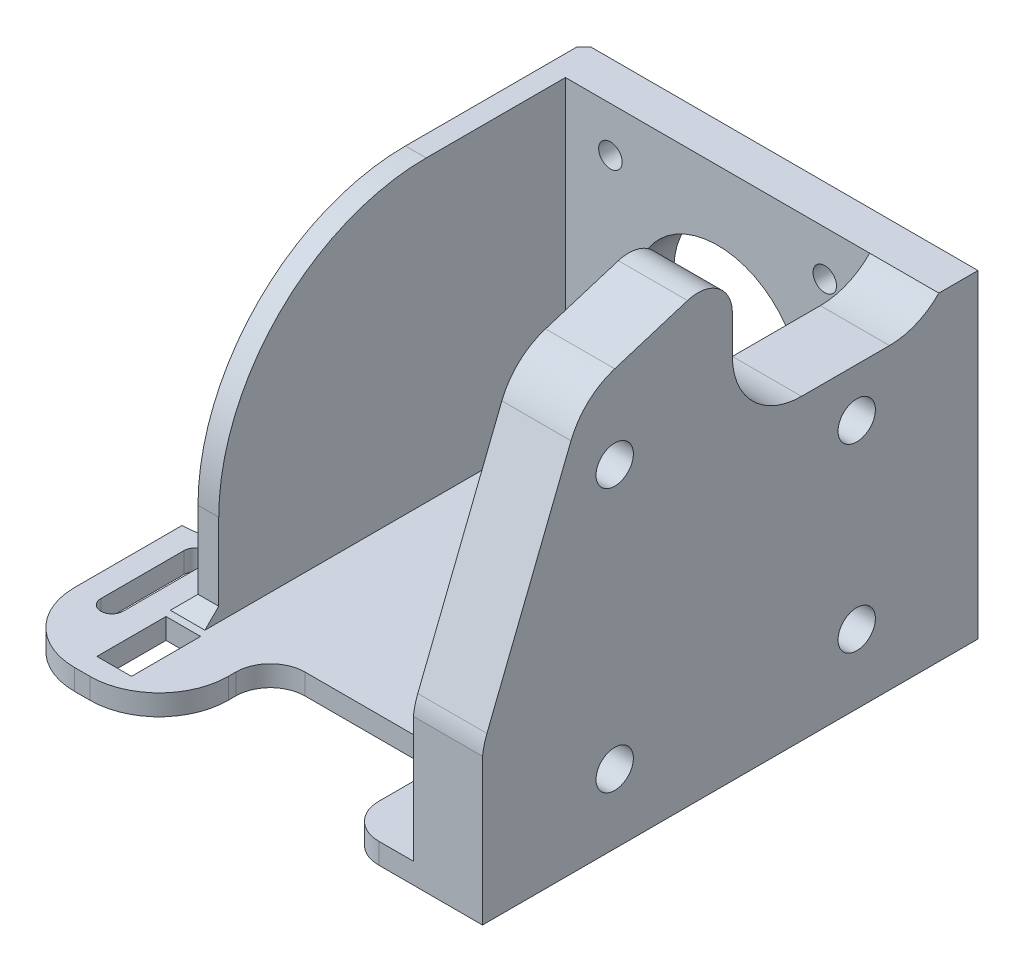
from build123d import *

# Parameters (mm, degrees)
SKETCH_1_W            = 44
SKETCH_1_H            = 44
EXTRUDE_2_DEPTH       = 5
SKETCH_2_R            = 1.5
SKETCH_2_R_2          = 10
CUT_EXTRUDE_1_DEPTH   = 32.511902513
SKETCH_3_R            = 12
CUT_EXTRUDE_3_DEPTH   = 32.511902513
EXTRUDE_4_DEPTH       = 3
EXTRUDE_5_REACH       = 63.87
SKETCH_6_W            = 44
SKETCH_6_H            = 0.85
SKETCH_7_W            = 44
SKETCH_7_H            = 0.85
CUT_EXTRUDE_4_DEPTH   = 62.869792746
SKETCH_8_W            = 52.142796764
SKETCH_8_H            = 46.15
EXTRUDE_6_DEPTH       = 3
SKETCH_10_W           = 3
SKETCH_10_H           = 43.15
SKETCH_10_W_2         = 47
SKETCH_10_H_2         = 3
EXTRUDE_7_DEPTH       = 3
SKETCH_11_W           = 1
SKETCH_11_H           = 46.15
CUT_EXTRUDE_5_DEPTH   = 77.373755538
SKETCH_12_R           = 1.55
CUT_EXTRUDE_6_DEPTH   = 65.340228018
SKETCH_14_W           = 54.142796764
SKETCH_14_H           = 46.15
EXTRUDE_8_DEPTH       = 5
EXTRUDE_9_DEPTH       = 5
SKETCH_17_W           = 70
SKETCH_17_H           = 13.120666122
EXTRUDE_10_DEPTH      = 5
CUT_EXTRUDE_8_DEPTH   = 98.040990462
EXTRUDE_12_DEPTH      = 5
CUT_EXTRUDE_9_DEPTH   = 98.040990462
FILLET_2_R            = 5
SKETCH_23_W           = 10
SKETCH_23_H           = 15.857203236
EXTRUDE_13_DEPTH      = 3
FILLET_3_R            = 5
FILLET_4_R            = 5
EXTRUDE_14_DEPTH      = 3
FILLET_5_R            = 5
SKETCH_26_W           = 3
SKETCH_26_H           = 25.543326292
CUT_EXTRUDE_10_DEPTH  = 102.638722513
FILLET_10_R           = 10
FILLET_11_R           = 12
CHAMFER_1_SIZE        = 2
CUT_EXTRUDE_11_DEPTH  = 101.502684118
FILLET_12_R           = 30
SKETCH_28_W           = 2
SKETCH_28_H           = 10
CUT_EXTRUDE_12_DEPTH  = 5
CHAMFER_2_SIZE        = 1
SKETCH_29_R           = 2.55
CUT_EXTRUDE_14_DEPTH  = 12
SKETCH_30_R           = 4.5
CUT_EXTRUDE_15_DEPTH  = 4
FILLET_13_R           = 1
SKETCH_33_R           = 7.046537577
EXTRUDE_15_DEPTH      = 10
CUT_EXTRUDE_START     = -10
CUT_EXTRUDE_16_DEPTH  = 10
SKETCH_35_R           = 4.5
CUT_EXTRUDE_17_DEPTH  = 4
FILLET_15_R           = 1
SKETCH_36_R           = 1.7
CUT_EXTRUDE_18_DEPTH  = 10
EXTRUDE_16_DEPTH      = 1.66
EXTRUDE_16_DEPTH_BACK = 2
SKETCH_37_W           = 57
SKETCH_37_H           = 46.15
SKETCH_37_R           = 1.7
CHAMFER_3_SIZE        = 1
SKETCH_38_W           = 29.862624896
SKETCH_38_H           = 3
CUT_EXTRUDE_19_DEPTH  = 101.429822344
FILLET_16_R           = 10
SKETCH_39_R           = 2.7
CUT_EXTRUDE_20_DEPTH  = 10
SKETCH_40_R           = 12
CUT_EXTRUDE_21_DEPTH  = 10
SKETCH_41_R           = 5.5
CUT_EXTRUDE_22_DEPTH  = 4
FILLET_17_R           = 1
SKETCH_42_W           = 5
SKETCH_42_H           = 10
CUT_EXTRUDE_23_DEPTH  = 10


# Read off the part's stored shape, not the designer's step: Вырез-Вытянуть16
with BuildPart() as part:
    # Эскиз1 → Бобышка-Вытянуть2 (new body)
    with BuildSketch(Plane.XY):
        Rectangle(SKETCH_1_W, SKETCH_1_H)
    extrude(amount=EXTRUDE_2_DEPTH)

    # Эскиз2 → Вырез-Вытянуть1 (cut, through all)
    with BuildSketch(Plane.XY.offset(5)):
        with Locations((-15.5, 15.5)):
            Circle(SKETCH_2_R)
        Circle(SKETCH_2_R_2)
        with Locations((15.5, 15.5)):
            Circle(SKETCH_2_R)
        with Locations((15.5, -15.5)):
            Circle(SKETCH_2_R)
        with Locations((-15.5, -15.5)):
            Circle(SKETCH_2_R)
    extrude(amount=-CUT_EXTRUDE_1_DEPTH, mode=Mode.SUBTRACT)

    # Эскиз3 → Вырез-Вытянуть3 (cut, through all)
    with BuildSketch(Plane.XY.offset(5)):
        Circle(SKETCH_3_R)
    extrude(amount=-CUT_EXTRUDE_3_DEPTH, mode=Mode.SUBTRACT)

    # Эскиз5 → Бобышка-Вытянуть4 (add)
    with BuildSketch(Plane.XZ.offset(22)):
        Polygon((-22, 5), (-22, 52.142796764), (22, 52.142796764), (22, 5), (22, 0), (-22, 0), align=None)
    extrude(amount=EXTRUDE_4_DEPTH)

    # Эскиз6 → Бобышка-Вытянуть5 (add, up to next)
    with BuildSketch(Plane.XY.offset(52.142796764), mode=Mode.PRIVATE) as extrude_5_sk1:
        with Locations((0, -21.575)):
            Rectangle(SKETCH_6_W, SKETCH_6_H)
    extrude_5_tool1 = extrude(extrude_5_sk1.sketch, amount=-EXTRUDE_5_REACH, mode=Mode.PRIVATE) - part.part
    add(extrude_5_tool1.solids().sort_by_distance((0, -21.575, 52.142797))[0])

    # Эскиз7 → Вырез-Вытянуть4 (cut, through all)
    with BuildSketch(Plane.XY.offset(52.142796764)):
        with Locations((0, -24.575)):
            Rectangle(SKETCH_7_W, SKETCH_7_H)
    extrude(amount=-CUT_EXTRUDE_4_DEPTH, mode=Mode.SUBTRACT)

    # Эскиз8 → Бобышка-Вытянуть6 (add)
    with BuildSketch(Plane.ZY.offset(22)):
        with Locations((26.071398382, -1.075)):
            Rectangle(SKETCH_8_W, SKETCH_8_H)
    extrude(amount=EXTRUDE_6_DEPTH)

    # Эскиз10 → Бобышка-Вытянуть7 (add)
    with BuildSketch(Plane.XY.offset(52.142796764)):
        with Locations((-23.5, 0.425)):
            Rectangle(SKETCH_10_W, SKETCH_10_H)
        with Locations((-1.5, -22.65)):
            Rectangle(SKETCH_10_W_2, SKETCH_10_H_2)
    extrude(amount=EXTRUDE_7_DEPTH)

    # Эскиз11 → Вырез-Вытянуть5 (cut, through all)
    with BuildSketch(Plane(origin=(22, 0, 0), x_dir=(0, 0, -1), z_dir=(1, 0, 0))):
        with Locations((-0.5, -1.075)):
            Rectangle(SKETCH_11_W, SKETCH_11_H)
    extrude(amount=-CUT_EXTRUDE_5_DEPTH, mode=Mode.SUBTRACT)

    # Эскиз12 → Вырез-Вытянуть6 (cut, through all)
    with BuildSketch(Plane(origin=(0, 0, 1), x_dir=(-1, 0, 0), z_dir=(0, 0, -1))):
        with Locations(Location((-15.5, 15.5, 0), (0, 0, 90))):
            Circle(SKETCH_12_R)
        with Locations(Location((15.5, 15.5, 0), (0, 0, 90))):
            Circle(SKETCH_12_R)
        with Locations(Location((15.5, -15.5, 0), (0, 0, 90))):
            Circle(SKETCH_12_R)
        with Locations(Location((-15.5, -15.5, 0), (0, 0, 90))):
            Circle(SKETCH_12_R)
    extrude(amount=-CUT_EXTRUDE_6_DEPTH, mode=Mode.SUBTRACT)

    # Эскиз14 → Бобышка-Вытянуть8 (add)
    with BuildSketch(Plane(origin=(22, 0, 0), x_dir=(0, 0, -1), z_dir=(1, 0, 0))):
        with Locations((-28.071398382, -1.075)):
            Rectangle(SKETCH_14_W, SKETCH_14_H)
    extrude(amount=EXTRUDE_8_DEPTH)

    # Эскиз15 → Бобышка-Вытянуть9 (add)
    with BuildSketch(Plane(origin=(27, 0, 0), x_dir=(0, 0, -1), z_dir=(1, 0, 0))):
        Polygon((-1, 22), (-1, 33.429885216), (-71, 33.429885216), (-71, -24.15), (-55.142796764, -24.15), (-55.142796764, 22), align=None)
    extrude(amount=-EXTRUDE_9_DEPTH)

    # Эскиз17 → Бобышка-Вытянуть10 (add)
    with BuildSketch(Plane.ZY.offset(-22)):
        with Locations((36, 39.990218277)):
            Rectangle(SKETCH_17_W, SKETCH_17_H)
    extrude(amount=-EXTRUDE_10_DEPTH)

    # Эскиз18 → Вырез-Вытянуть8 (cut, through all)
    with BuildSketch(Plane.ZY.offset(-22)):
        with BuildLine():
            Line((58.201410897, 30.108398015), (70.359252493, -0.469322049))
            ThreePointArc((70.359252493, -0.469322049), (70.763191451, -1.718511281), (71, -3.009852494))
            Line((71, -3.009852494), (71, 46.550551338))
            Line((71, 46.550551338), (17.845614556, 46.550551338))
            Line((17.845614556, 46.550551338), (18.317714835, 46.403676699))
            Line((18.317714835, 46.403676699), (51.879635236, 35.962261704))
            ThreePointArc((51.879635236, 35.962261704), (55.703298309, 33.75108216), (58.201410897, 30.108398015))
        make_face()
    extrude(amount=-CUT_EXTRUDE_8_DEPTH, mode=Mode.SUBTRACT)

    # Эскиз21 → Бобышка-Вытянуть12 (add)
    with BuildSketch(Plane(origin=(27, 0, 0), x_dir=(0, 0, -1), z_dir=(1, 0, 0))):
        with BuildLine():
            Line((-1, 46.550551338), (-17.845614556, 46.550551338))
            Line((-17.845614556, 46.550551338), (-51.879635236, 35.962261704))
            ThreePointArc((-51.879635236, 35.962261704), (-55.703298309, 33.75108216), (-58.201410897, 30.108398015))
            Line((-58.201410897, 30.108398015), (-70.359252493, -0.469322049))
            ThreePointArc((-70.359252493, -0.469322049), (-70.763191451, -1.718511281), (-71, -3.009852494))
            Line((-71, -3.009852494), (-71, -24.15))
            Line((-71, -24.15), (-1, -24.15))
            Line((-1, -24.15), (-1, 46.550551338))
        make_face()
    extrude(amount=EXTRUDE_12_DEPTH)

    # Эскиз22 → Вырез-Вытянуть9 (cut, through all)
    with BuildSketch(Plane.ZY.offset(-22)):
        Polygon((1, 22), (1, 46.550551338), (17.845614556, 46.550551338), (34.862624896, 41.256406521), (34.862624896, 22), align=None)
    extrude(amount=-CUT_EXTRUDE_9_DEPTH, mode=Mode.SUBTRACT)

    # Скругление2
    fillet_2_edges = [part.edges().sort_by_distance(p)[0] for p in [
        (27, 41.256406521, 34.862624896),
    ]]
    fillet(fillet_2_edges, radius=FILLET_2_R)

    # Эскиз23 → Бобышка-Вытянуть13 (add)
    with BuildSketch(Plane(origin=(0, -21.15, 0), x_dir=(1, 0, 0), z_dir=(0, 1, 0))):
        with Locations((17, -63.071398382)):
            Rectangle(SKETCH_23_W, SKETCH_23_H)
    extrude(amount=-EXTRUDE_13_DEPTH)

    # Скругление3
    fillet_3_edges = [part.edges().sort_by_distance(p)[0] for p in [
        (12, -22.65, 55.142796764),
    ]]
    fillet(fillet_3_edges, radius=FILLET_3_R)

    # Скругление4
    fillet_4_edges = [part.edges().sort_by_distance(p)[0] for p in [
        (12, -22.65, 71),
    ]]
    fillet(fillet_4_edges, radius=FILLET_4_R)

    # Эскиз25 → Бобышка-Вытянуть14 (add)
    with BuildSketch(Plane.XZ.offset(24.15)):
        Polygon((-25, 45.691438505), (-39.773399836, 45.691438505), (-39.773399836, 71.234764797), (-14.530583265, 71.234764797), (-14.530583265, 45.691438505), align=None)
    extrude(amount=-EXTRUDE_14_DEPTH)

    # Скругление5
    fillet_5_edges = [part.edges().sort_by_distance(p)[0] for p in [
        (-14.530583265, -22.65, 55.142796764),
    ]]
    fillet(fillet_5_edges, radius=FILLET_5_R)

    # Эскиз26 → Вырез-Вытянуть10 (cut, through all)
    with BuildSketch(Plane(origin=(0, -21.15, 0), x_dir=(1, 0, 0), z_dir=(0, 1, 0))):
        with Locations((-38.273399836, -58.463101651)):
            Rectangle(SKETCH_26_W, SKETCH_26_H)
    extrude(amount=-CUT_EXTRUDE_10_DEPTH, mode=Mode.SUBTRACT)

    # Скругление10
    fillet_10_edges = [part.edges().sort_by_distance(p)[0] for p in [
        (-14.530583265, -22.65, 71.234764797),
        (-36.773399836, -22.65, 71.234764797),
    ]]
    fillet(fillet_10_edges, radius=FILLET_10_R)

    # Скругление11
    # the kernel refuses this fillet: 12 mm, written as the material it adds along each edge
    with BuildSketch(Plane(origin=(-25, -21.15, 45.691438505), x_dir=(-1, 0, 0), z_dir=(0, -1, 0))) as fillet_11_piece_1:
        with BuildLine():
            CenterArc((12, 11.997860324), FILLET_11_R, 180, 88.917999605)
            Line((0, 11.997860324), (-0.24, 11.997860324))
            Line((-0.24, 11.997860324), (-0.24, 0))
            Line((-0.24, 0), (0, -0.24))
            ThreePointArc((0, -0.24), (5.886699918, -0.24), (11.768867833, -0.239957206))
            Line((11.768867833, -0.239957206), (11.773399836, 0))
        make_face()
    extrude(amount=3)

    # Фаска1
    chamfer_1_edges = [part.edges().sort_by_distance(p)[0] for p in [
        (-23.5, -21.15, 55.142796764),
        (-25, -21.15, 44.418187472),
    ]]
    chamfer(chamfer_1_edges, length=CHAMFER_1_SIZE)

    # Эскиз27 → Вырез-Вытянуть11 (cut, through all)
    with BuildSketch(Plane(origin=(0, -21.15, 0), x_dir=(1, 0, 0), z_dir=(0, 1, 0))):
        with BuildLine():
            Line((-33.486699918, -48.691438505), (-33.486699918, -60.691438505))
            ThreePointArc((-33.486699918, -60.691438505), (-31.886699918, -62.291438505), (-30.286699918, -60.691438505))
            Line((-30.286699918, -60.691438505), (-30.286699918, -48.691438505))
            ThreePointArc((-30.286699918, -48.691438505), (-31.886699918, -47.091438505), (-33.486699918, -48.691438505))
        make_face()
    extrude(amount=-CUT_EXTRUDE_11_DEPTH, mode=Mode.SUBTRACT)

    # Скругление12
    fillet_12_edges = [part.edges().sort_by_distance(p)[0] for p in [
        (-23.5, 22, 55.142796764),
    ]]
    fillet(fillet_12_edges, radius=FILLET_12_R)

    # Эскиз28 → Вырез-Вытянуть12 (cut)
    with BuildSketch(Plane(origin=(0, -21.15, 0), x_dir=(1, 0, 0), z_dir=(0, 1, 0))):
        with Locations((-23.530583265, -63.234764797)):
            Rectangle(SKETCH_28_W, SKETCH_28_H)
        with Locations((-25.530583265, -63.234764797)):
            Rectangle(SKETCH_28_W, SKETCH_28_H)
    extrude(amount=-CUT_EXTRUDE_12_DEPTH, mode=Mode.SUBTRACT)

    # Фаска2
    chamfer_2_edges = [part.edges().sort_by_distance(p)[0] for p in [
        (-25, -1.075, 1),
    ]]
    chamfer(chamfer_2_edges, length=CHAMFER_2_SIZE)

    # Эскиз29 → Вырез-Вытянуть14 (cut)
    with BuildSketch(Plane(origin=(32, 0, 0), x_dir=(0, 0, -1), z_dir=(1, 0, 0))):
        with Locations(Location((-46.879635236, 23.962261704, 0), (0, 0, 90))):
            Circle(SKETCH_29_R)
        with Locations(Location((-51.879635236, -14.15, 0), (0, 0, 90))):
            Circle(SKETCH_29_R)
        with Locations(Location((-16.879635236, -14.15, 0), (0, 0, 90))):
            Circle(SKETCH_29_R)
        with Locations(Location((-16.879635236, 12, 0), (0, 0, 90))):
            Circle(SKETCH_29_R)
    extrude(amount=-CUT_EXTRUDE_14_DEPTH, mode=Mode.SUBTRACT)

    # Эскиз30 → Вырез-Вытянуть15 (cut)
    with BuildSketch(Plane.ZY.offset(-22)):
        with Locations(Location((46.879635236, 23.962261704, 0), (0, 0, 270))):
            Circle(SKETCH_30_R)
        with Locations(Location((16.879635236, 12, 0), (0, 0, 270))):
            Circle(SKETCH_30_R)
        with Locations(Location((16.879635236, -14.15, 0), (0, 0, 270))):
            Circle(SKETCH_30_R)
        with Locations(Location((51.879635236, -14.15, 0), (0, 0, 270))):
            Circle(SKETCH_30_R)
    extrude(amount=-CUT_EXTRUDE_15_DEPTH, mode=Mode.SUBTRACT)

    # Скругление13
    fillet_13_edges = [part.edges().sort_by_distance(p)[0] for p in [
        (22, 28.462261704, 46.879635236),
        (22, 16.5, 16.879635236),
        (22, -9.65, 16.879635236),
        (22, -9.65, 51.879635236),
    ]]
    fillet(fillet_13_edges, radius=FILLET_13_R)

    # Эскиз33 → Бобышка-Вытянуть15 (add)
    with BuildSketch(Plane.ZY.offset(-22)):
        with Locations((46.879635236, 23.962261704)):
            Circle(SKETCH_33_R)
    extrude(amount=-EXTRUDE_15_DEPTH)

    # Вырез-Вытянуть16 outline → Вырез-Вытянуть16 (cut)
    with BuildSketch(Plane(origin=(32, 0, 0), x_dir=(0, 0, -1), z_dir=(1, 0, 0)).offset(CUT_EXTRUDE_START)):
        with BuildLine():
            ThreePointArc((-49.404885236, 23.607843254), (-49.429635236, 23.962261703), (-49.404885236, 24.316680153))
            ThreePointArc((-49.404885236, 24.316680153), (-54.379635236, 23.962261703), (-49.404885236, 23.607843254))
        make_face()
    extrude(amount=CUT_EXTRUDE_16_DEPTH, mode=Mode.SUBTRACT)

    # Эскиз35 → Вырез-Вытянуть17 (cut)
    with BuildSketch(Plane.ZY.offset(-22)):
        with Locations(Location((51.879635236, 23.962261704, 0), (0, 0, 270))):
            Circle(SKETCH_35_R)
    extrude(amount=-CUT_EXTRUDE_17_DEPTH, mode=Mode.SUBTRACT)

    # Скругление15
    fillet_15_edges = [part.edges().sort_by_distance(p)[0] for p in [
        (22, 28.462261704, 51.879635236),
    ]]
    fillet(fillet_15_edges, radius=FILLET_15_R)

    # Эскиз36 → Вырез-Вытянуть18 (cut)
    with BuildSketch(Plane(origin=(0, 0, 1), x_dir=(-1, 0, 0), z_dir=(0, 0, -1))):
        with Locations(Location((-15.5, 15.5, 0), (0, 0, 90))):
            Circle(SKETCH_36_R)
        with Locations(Location((15.5, 15.5, 0), (0, 0, 90))):
            Circle(SKETCH_36_R)
        with Locations(Location((15.5, -15.5, 0), (0, 0, 90))):
            Circle(SKETCH_36_R)
        with Locations(Location((-15.5, -15.5, 0), (0, 0, 90))):
            Circle(SKETCH_36_R)
    extrude(amount=-CUT_EXTRUDE_18_DEPTH, mode=Mode.SUBTRACT)

    # Эскиз37 → Бобышка-Вытянуть16 (add, two sides: drawn at the far end of the back side and taken through both)
    with BuildSketch(Plane(origin=(0, 0, 1), x_dir=(-1, 0, 0), z_dir=(0, 0, -1)).offset(-EXTRUDE_16_DEPTH_BACK)):
        with Locations((-3.5, -1.075)):
            Rectangle(SKETCH_37_W, SKETCH_37_H)
        with Locations(Location((-15.5, -15.5, 0), (0, 0, 90))):
            Circle(SKETCH_37_R, mode=Mode.SUBTRACT)
        with Locations(Location((15.5, -15.5, 0), (0, 0, 90))):
            Circle(SKETCH_37_R, mode=Mode.SUBTRACT)
        with Locations(Location((15.5, 15.5, 0), (0, 0, 90))):
            Circle(SKETCH_37_R, mode=Mode.SUBTRACT)
        with Locations(Location((-15.5, 15.5, 0), (0, 0, 90))):
            Circle(SKETCH_37_R, mode=Mode.SUBTRACT)
    extrude(amount=EXTRUDE_16_DEPTH + EXTRUDE_16_DEPTH_BACK)

    # Фаска3
    chamfer_3_edges = [part.edges().sort_by_distance(p)[0] for p in [
        (-25, -1.075, -0.66),
    ]]
    chamfer(chamfer_3_edges, length=CHAMFER_3_SIZE)

    # Эскиз38 → Вырез-Вытянуть19 (cut, through all)
    with BuildSketch(Plane.ZY.offset(-22)):
        with Locations((19.931312448, 20.5)):
            Rectangle(SKETCH_38_W, SKETCH_38_H)
    extrude(amount=-CUT_EXTRUDE_19_DEPTH, mode=Mode.SUBTRACT)

    # Скругление16
    # the kernel refuses this fillet: 10 mm, written as the material it adds along each edge
    with BuildSketch(Plane(origin=(22, 19, 34.862624896), x_dir=(0, 1, 0), z_dir=(1, 0, 0))) as fillet_16_piece_1:
        with BuildLine():
            CenterArc((FILLET_16_R, -FILLET_16_R), FILLET_16_R, 90, 90)
            Line((0, -FILLET_16_R), (-FILLET_16_R * 0.02, -FILLET_16_R))
            Line((-FILLET_16_R * 0.02, -FILLET_16_R), (-FILLET_16_R * 0.02, FILLET_16_R * 0.02))
            Line((-FILLET_16_R * 0.02, FILLET_16_R * 0.02), (FILLET_16_R, FILLET_16_R * 0.02))
            Line((FILLET_16_R, FILLET_16_R * 0.02), (FILLET_16_R, 0))
        make_face()
    extrude(amount=10)
    with BuildSketch(Plane(origin=(22, 19, 5), x_dir=(0, 0, 1), z_dir=(1, 0, 0))) as fillet_16_piece_2:
        with BuildLine():
            CenterArc((7.141428429, -10), FILLET_16_R, 90, 45.572995999)
            Line((0, -3), (-0.142828569, -2.86))
            ThreePointArc((-0.142828569, -2.86), (-0.2, -1.5), (-0.2, 0))
            Line((-0.2, 0), (0, 0.2))
            Line((0, 0.2), (7.141428429, 0.2))
            Line((7.141428429, 0.2), (7.141428429, 0))
        make_face()
    extrude(amount=10)

    # Эскиз39 → Вырез-Вытянуть20 (cut)
    with BuildSketch(Plane(origin=(32, 0, 0), x_dir=(0, 0, -1), z_dir=(1, 0, 0))):
        with Locations(Location((-51.879635236, 23.962261704, 0), (0, 0, 90))):
            Circle(SKETCH_39_R)
        with Locations(Location((-16.879635236, 12, 0), (0, 0, 90))):
            Circle(SKETCH_39_R)
        with Locations(Location((-16.879635236, -14.15, 0), (0, 0, 90))):
            Circle(SKETCH_39_R)
        with Locations(Location((-51.879635236, -14.15, 0), (0, 0, 90))):
            Circle(SKETCH_39_R)
    extrude(amount=-CUT_EXTRUDE_20_DEPTH, mode=Mode.SUBTRACT)

    # Эскиз40 → Вырез-Вытянуть21 (cut)
    with BuildSketch(Plane.XY.offset(5)):
        Circle(SKETCH_40_R)
    extrude(amount=-CUT_EXTRUDE_21_DEPTH, mode=Mode.SUBTRACT)

    # Эскиз41 → Вырез-Вытянуть22 (cut)
    with BuildSketch(Plane.ZY.offset(-22)):
        with Locations(Location((51.879635236, 23.962261704, 0), (0, 0, 270))):
            Circle(SKETCH_41_R)
        with Locations(Location((51.879635236, -14.15, 0), (0, 0, 270))):
            Circle(SKETCH_41_R)
        with Locations(Location((16.879635236, 12, 0), (0, 0, 270))):
            Circle(SKETCH_41_R)
        with Locations(Location((16.879635236, -14.15, 0), (0, 0, 270))):
            Circle(SKETCH_41_R)
    extrude(amount=-CUT_EXTRUDE_22_DEPTH, mode=Mode.SUBTRACT)

    # Скругление17
    fillet_17_edges = [part.edges().sort_by_distance(p)[0] for p in [
        (22, 29.462261704, 51.879635236),
        (22, -8.65, 51.879635236),
        (22, 17.5, 16.879635236),
        (22, -8.65, 16.879635236),
    ]]
    fillet(fillet_17_edges, radius=FILLET_17_R)

    # Эскиз42 → Вырез-Вытянуть23 (cut)
    with BuildSketch(Plane(origin=(0, -21.15, 0), x_dir=(1, 0, 0), z_dir=(0, 1, 0))):
        with Locations((-24.030583265, -63.234764797)):
            Rectangle(SKETCH_42_W, SKETCH_42_H)
    extrude(amount=-CUT_EXTRUDE_23_DEPTH, mode=Mode.SUBTRACT)


solid = part.part
